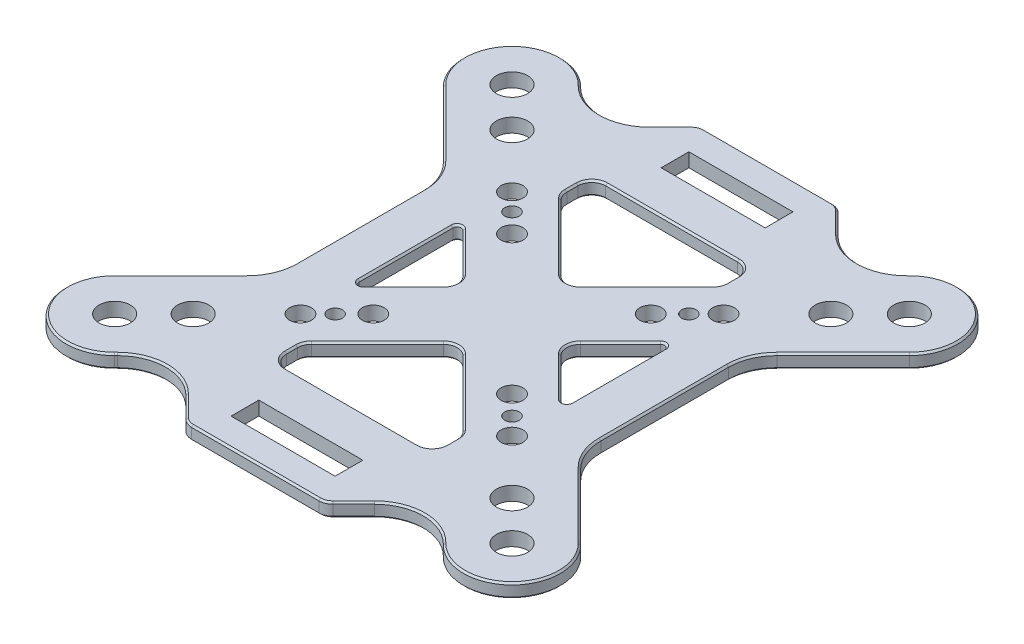
from build123d import *

# Parameters (mm, degrees)
SKETCH1_R           = 2.25
SKETCH1_R_2         = 1.575
SKETCH1_R_3         = 1.05
BOSS_EXTRUDE1_DEPTH = 2
MIRROR1_OUTLINE_R   = 2.25
MIRROR1_OUTLINE_R_2 = 1.575
MIRROR1_OUTLINE_R_3 = 1.05
MIRROR1_OUTLINE_W   = 15
MIRROR1_OUTLINE_H   = 4
MIRROR1_DEPTH       = 2
FILLET1_R           = 2
FILLET2_R           = 0.6
CHAMFER1_SIZE       = 0.25


# Read off the part's stored shape, not the designer's step: Mirror1
with BuildPart() as part:
    # Sketch1 → Boss-Extrude1 (new body)
    with BuildSketch(Plane(origin=(0, 0, 0), x_dir=(1, 0, 0), z_dir=(0, 1, 0))):
        with BuildLine():
            Line((-7.071067812, 0), (0, 0))
            Line((0, 0), (0, 7.071067812))
            Line((0, 7.071067812), (-11.5, 18.571067812))
            Line((-11.5, 18.571067812), (-11.5, 23))
            Line((-11.5, 23), (0, 23))
            Line((0, 23), (0, 29))
            Line((0, 29), (-7.5, 29))
            Line((-7.5, 29), (-7.5, 33))
            Line((-7.5, 33), (0, 33))
            Line((0, 33), (0, 37))
            Line((0, 37), (-9.171572875, 37))
            ThreePointArc((-9.171572875, 37), (-9.93693974, 36.847759065), (-10.585786438, 36.414213562))
            Line((-10.585786438, 36.414213562), (-13.600505063, 33.399494937))
            ThreePointArc((-13.600505063, 33.399494937), (-18.550252532, 31.349242405), (-23.5, 33.399494937))
            Line((-23.5, 33.399494937), (-23.68807717, 33.587572106))
            ThreePointArc((-23.68807717, 33.587572106), (-33.587572106, 33.587572106), (-33.587572106, 23.68807717))
            Line((-33.587572106, 23.68807717), (-24.050252532, 14.150757595))
            ThreePointArc((-24.050252532, 14.150757595), (-22.532843272, 11.879794153), (-22, 9.201010127))
            Line((-22, 9.201010127), (-22, 0))
            Line((-22, 0), (-15.25, 0))
            Line((-15.25, 0), (-15.25, 8.178932188))
            Line((-15.25, 8.178932188), (-7.071067812, 0))
        make_face()
        with Locations(Location((-22.980970389, 22.980970389, 0), (0, 0, 270))):
            Circle(SKETCH1_R, mode=Mode.SUBTRACT)
        with Locations(Location((-28.637824638, 28.637824638, 0), (0, 0, 270))):
            Circle(SKETCH1_R, mode=Mode.SUBTRACT)
        with Locations(Location((-15.25, 15.25, 0), (0, 0, 270))):
            Circle(SKETCH1_R_2, mode=Mode.SUBTRACT)
        with Locations(Location((-12.75, 12.75, 0), (0, 0, 270))):
            Circle(SKETCH1_R_3, mode=Mode.SUBTRACT)
        with Locations(Location((-10, 10, 0), (0, 0, 270))):
            Circle(SKETCH1_R_2, mode=Mode.SUBTRACT)
    extrude(amount=BOSS_EXTRUDE1_DEPTH)

    # Mirror1 outline → Mirror1 (add)
    with BuildSketch(Plane(origin=(0, 0, 0), x_dir=(1, 0, 0), z_dir=(0, 1, 0))):
        with BuildLine():
            Line((33.587572106, -23.68807717), (24.050252532, -14.150757595))
            ThreePointArc((24.050252532, -14.150757595), (22.532843272, -11.879794154), (22, -9.201010127))
            Line((22, -9.201010127), (22, 9.201010127))
            ThreePointArc((22, 9.201010127), (22.532843272, 11.879794154), (24.050252532, 14.150757595))
            Line((24.050252532, 14.150757595), (33.587572106, 23.68807717))
            ThreePointArc((33.587572106, 23.68807717), (33.587572106, 33.587572106), (23.68807717, 33.587572106))
            Line((23.68807717, 33.587572106), (23.5, 33.399494937))
            ThreePointArc((23.5, 33.399494937), (18.550252531, 31.349242405), (13.600505063, 33.399494937))
            Line((13.600505063, 33.399494937), (10.585786438, 36.414213562))
            ThreePointArc((10.585786438, 36.414213562), (9.93693974, 36.847759065), (9.171572875, 37))
            Line((9.171572875, 37), (0, 37))
            Line((0, 37), (0, 33))
            Line((0, 33), (7.5, 33))
            Line((7.5, 33), (7.5, 29))
            Line((7.5, 29), (0, 29))
            Line((0, 29), (0, 23))
            Line((0, 23), (11.5, 23))
            Line((11.5, 23), (11.5, 18.571067812))
            Line((11.5, 18.571067812), (0, 7.071067812))
            Line((0, 7.071067812), (0, 0))
            Line((0, 0), (-7.071067812, 0))
            Line((-7.071067812, 0), (-15.25, -8.178932188))
            Line((-15.25, -8.178932188), (-15.25, 0))
            Line((-15.25, 0), (-22, 0))
            Line((-22, 0), (-22, -9.201010127))
            ThreePointArc((-22, -9.201010127), (-22.532843272, -11.879794154), (-24.050252532, -14.150757595))
            Line((-24.050252532, -14.150757595), (-33.587572106, -23.68807717))
            ThreePointArc((-33.587572106, -23.68807717), (-33.587572106, -33.587572106), (-23.68807717, -33.587572106))
            Line((-23.68807717, -33.587572106), (-23.5, -33.399494937))
            ThreePointArc((-23.5, -33.399494937), (-18.550252531, -31.349242405), (-13.600505063, -33.399494937))
            Line((-13.600505063, -33.399494937), (-10.585786438, -36.414213562))
            ThreePointArc((-10.585786438, -36.414213562), (-9.93693974, -36.847759065), (-9.171572875, -37))
            Line((-9.171572875, -37), (9.171572875, -37))
            ThreePointArc((9.171572875, -37), (9.93693974, -36.847759065), (10.585786438, -36.414213562))
            Line((10.585786438, -36.414213562), (13.600505063, -33.399494937))
            ThreePointArc((13.600505063, -33.399494937), (18.550252531, -31.349242405), (23.5, -33.399494937))
            Line((23.5, -33.399494937), (23.68807717, -33.587572106))
            ThreePointArc((23.68807717, -33.587572106), (33.587572106, -33.587572106), (33.587572106, -23.68807717))
        make_face()
        with Locations((-28.637824638, -28.637824638)):
            Circle(MIRROR1_OUTLINE_R, mode=Mode.SUBTRACT)
        with Locations((-22.980970389, -22.980970389)):
            Circle(MIRROR1_OUTLINE_R, mode=Mode.SUBTRACT)
        with Locations((-15.25, -15.25)):
            Circle(MIRROR1_OUTLINE_R_2, mode=Mode.SUBTRACT)
        with Locations((-12.75, -12.75)):
            Circle(MIRROR1_OUTLINE_R_3, mode=Mode.SUBTRACT)
        with Locations((-10, -10)):
            Circle(MIRROR1_OUTLINE_R_2, mode=Mode.SUBTRACT)
        with Locations((0, -31)):
            Rectangle(MIRROR1_OUTLINE_W, MIRROR1_OUTLINE_H, mode=Mode.SUBTRACT)
        with Locations((28.637824638, -28.637824638)):
            Circle(MIRROR1_OUTLINE_R, mode=Mode.SUBTRACT)
        with Locations((22.980970389, -22.980970389)):
            Circle(MIRROR1_OUTLINE_R, mode=Mode.SUBTRACT)
        Polygon((-11.5, -18.571067812), (0, -7.071067812), (11.5, -18.571067812), (11.5, -23), (-11.5, -23), align=None, mode=Mode.SUBTRACT)
        with Locations((15.25, -15.25)):
            Circle(MIRROR1_OUTLINE_R_2, mode=Mode.SUBTRACT)
        with Locations((12.75, -12.75)):
            Circle(MIRROR1_OUTLINE_R_3, mode=Mode.SUBTRACT)
        with Locations((10, -10)):
            Circle(MIRROR1_OUTLINE_R_2, mode=Mode.SUBTRACT)
        Polygon((15.25, -8.178932188), (7.071067812, 0), (15.25, 8.178932188), align=None, mode=Mode.SUBTRACT)
        with Locations((10, 10)):
            Circle(MIRROR1_OUTLINE_R_2, mode=Mode.SUBTRACT)
        with Locations((12.75, 12.75)):
            Circle(MIRROR1_OUTLINE_R_3, mode=Mode.SUBTRACT)
        with Locations((15.25, 15.25)):
            Circle(MIRROR1_OUTLINE_R_2, mode=Mode.SUBTRACT)
        with Locations((22.980970389, 22.980970389)):
            Circle(MIRROR1_OUTLINE_R, mode=Mode.SUBTRACT)
        with Locations((28.637824638, 28.637824638)):
            Circle(MIRROR1_OUTLINE_R, mode=Mode.SUBTRACT)
    extrude(amount=MIRROR1_DEPTH)

    # Fillet1
    fillet1_edges = [part.edges().sort_by_distance(p)[0] for p in [
        (-11.5, 1, 23),
        (-11.5, 1, 18.571067812),
        (0, 1, 7.071067812),
        (11.5, 1, 18.571067812),
        (11.5, 1, 23),
        (-11.5, 1, -23),
        (-11.5, 1, -18.571067812),
        (0, 1, -7.071067812),
        (-7.071067812, 1, 0),
        (11.5, 1, -23),
        (11.5, 1, -18.571067812),
        (7.071067812, 1, 0),
    ]]
    fillet(fillet1_edges, radius=FILLET1_R)

    # Fillet2
    fillet2_edges = [part.edges().sort_by_distance(p)[0] for p in [
        (-15.25, 1, 8.178932188),
        (15.25, 1, 8.178932188),
        (-15.25, 1, -8.178932188),
        (15.25, 1, -8.178932188),
    ]]
    fillet(fillet2_edges, radius=FILLET2_R)

    # Chamfer1
    chamfer1_edges = [part.edges().sort_by_distance(p)[0] for p in [
        (-23.594038585, 2, -33.493533521),
        (-9.93693974, 2, -36.847759065),
        (-12.093145751, 2, -34.906854249),
        (-18.550252532, 2, -31.349242405),
        (-23.594038585, 0, 33.493533521),
        (-18.550252531, 0, 31.349242405),
        (-12.09314575, 2, 34.90685425),
        (-9.93693974, 2, 36.847759065),
        (0, 2, 37),
        (-22.532843272, 0, 11.879794154),
        (-28.818912319, 2, 18.919417383),
        (-33.587572106, 2, 33.587572106),
        (-23.594038585, 2, 33.493533521),
        (-18.550252531, 2, 31.349242405),
        (-33.587572106, 2, -33.587572106),
        (-22.532843272, 2, 11.879794154),
        (-33.587572106, 0, 33.587572106),
        (-28.818912319, 0, 18.919417383),
        (0, 0, 37),
        (-9.93693974, 0, 36.847759065),
        (-12.09314575, 0, 34.90685425),
        (23.594038585, 2, 33.493533521),
        (33.587572106, 0, 33.587572106),
        (28.818912319, 0, 18.919417383),
        (22.532843272, 2, 11.879794154),
        (9.93693974, 0, 36.847759065),
        (12.09314575, 0, 34.90685425),
        (18.550252531, 2, 31.349242405),
        (33.587572106, 2, 33.587572106),
        (28.818912319, 2, 18.919417383),
        (9.93693974, 2, 36.847759065),
        (12.09314575, 2, 34.90685425),
        (23.594038585, 0, 33.493533521),
        (18.550252531, 0, 31.349242405),
        (22.532843272, 0, 11.879794154),
        (-28.818912319, 2, -18.919417382),
        (-22.532843272, 2, -11.879794153),
        (6.164213562, 0, 13.235281374),
        (6.164213562, 2, 13.235281374),
        (-6.164213562, 0, 13.235281374),
        (-6.164213562, 2, 13.235281374),
        (-6.164213562, 0, -13.235281374),
        (-6.164213562, 2, -13.235281374),
        (6.164213562, 0, -13.235281374),
        (6.164213562, 2, -13.235281374),
        (-11.5, 0, -20.199747468),
        (-11.5, 2, -20.199747468),
        (11.5, 0, -20.199747468),
        (11.5, 2, -20.199747468),
        (11.5, 0, 20.199747468),
        (11.5, 2, 20.199747468),
        (-11.5, 0, 20.199747468),
        (-11.5, 2, 20.199747468),
        (0, 0, 23),
        (0, 2, 23),
        (0, 0, -23),
        (0, 2, -23),
        (-7.899494937, 0, 0),
        (-7.899494937, 2, 0),
        (7.899494937, 0, 0),
        (-22, 2, 0),
        (7.899494937, 2, 0),
        (0, 0, 7.899494937),
        (0, 2, 7.899494937),
        (0, 0, -7.899494937),
        (0, 2, -7.899494937),
        (-11.347759065, 0, -18.634128072),
        (-11.347759065, 2, -18.634128072),
        (11.347759065, 0, -18.634128072),
        (11.347759065, 2, -18.634128072),
        (11.347759065, 0, 18.634128072),
        (11.347759065, 2, 18.634128072),
        (-18.550252532, 0, -31.349242405),
        (-11.347759065, 0, 18.634128072),
        (-11.347759065, 2, 18.634128072),
        (-12.093145751, 0, -34.906854249),
        (-10.914213562, 0, 22.414213562),
        (-10.914213562, 2, 22.414213562),
        (10.914213562, 0, 22.414213562),
        (-9.93693974, 0, -36.847759065),
        (10.914213562, 2, 22.414213562),
        (10.914213562, 0, -22.414213562),
        (0, 0, -37),
        (10.914213562, 2, -22.414213562),
        (-10.914213562, 0, -22.414213562),
        (-10.914213562, 2, -22.414213562),
        (-22, 0, 0),
        (-22.532843272, 0, -11.879794153),
        (11.355508653, 0, 4.284440841),
        (11.355508653, 2, 4.284440841),
        (-28.818912319, 0, -18.919417382),
        (15.25, 0, 0),
        (15.25, 2, 0),
        (11.355508653, 2, -4.284440841),
        (11.355508653, 0, -4.284440841),
        (-15.25, 0, 0),
        (-15.25, 2, 0),
        (-33.587572106, 0, -33.587572106),
        (-11.355508653, 2, 4.284440841),
        (-11.355508653, 0, 4.284440841),
        (-11.355508653, 0, -4.284440841),
        (-11.355508653, 2, -4.284440841),
        (14.879610059, 0, 7.28473177),
        (14.879610059, 2, 7.28473177),
        (-23.594038585, 0, -33.493533521),
        (14.879610059, 0, -7.28473177),
        (14.879610059, 2, -7.28473177),
        (-14.879610059, 0, 7.28473177),
        (-14.879610059, 2, 7.28473177),
        (-14.879610059, 0, -7.28473177),
        (-14.879610059, 2, -7.28473177),
        (23.594038585, 0, -33.493533521),
        (18.550252531, 0, -31.349242405),
        (12.09314575, 2, -34.90685425),
        (9.93693974, 2, -36.847759065),
        (22, 0, 0),
        (22.532843272, 0, -11.879794154),
        (28.818912319, 2, -18.919417383),
        (33.587572106, 2, -33.587572106),
        (23.594038585, 2, -33.493533521),
        (18.550252531, 2, -31.349242405),
        (22, 2, 0),
        (22.532843272, 2, -11.879794154),
        (0, 2, -37),
        (33.587572106, 0, -33.587572106),
        (28.818912319, 0, -18.919417383),
        (9.93693974, 0, -36.847759065),
        (12.09314575, 0, -34.90685425),
    ]]
    chamfer(chamfer1_edges, length=CHAMFER1_SIZE)


solid = part.part
